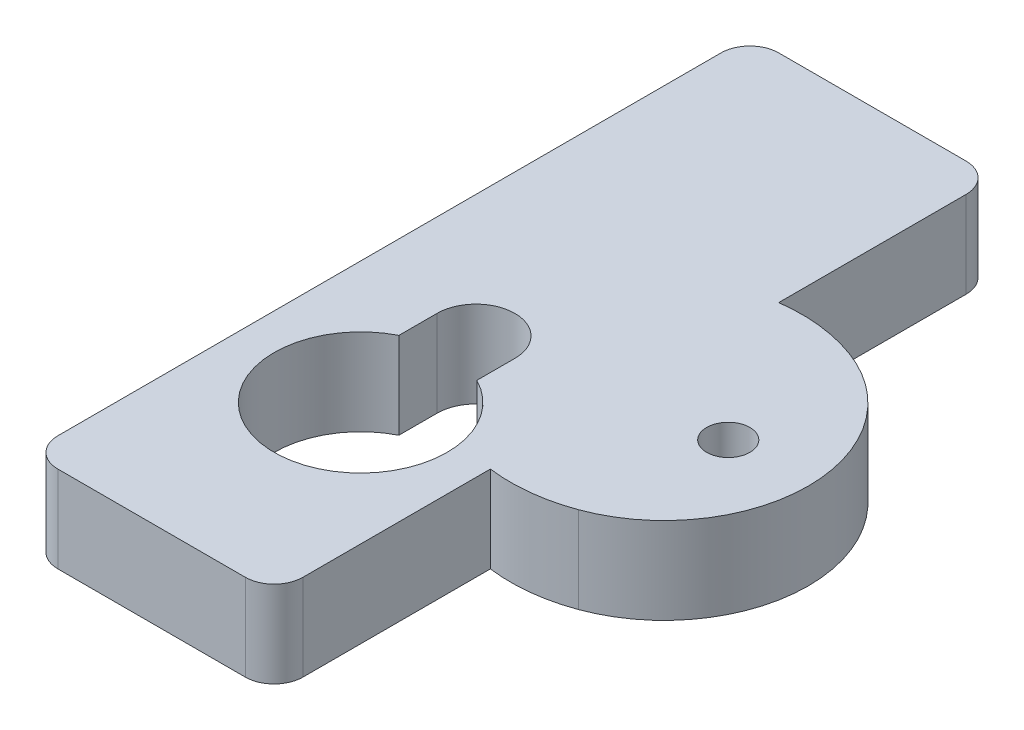
from build123d import *

# Parameters (mm, degrees)
ESQUISSE1_R        = 1.5
BOSS_EXTRU_2_DEPTH = 6
CONG_2_R           = 2
CONG_3_R           = 10


with BuildPart() as part:
    # Esquisse1 → Boss.-Extru.2 (new body)
    with BuildSketch(Plane(origin=(0, 0, 0), x_dir=(1, 0, 0), z_dir=(0, 1, 0))):
        with BuildLine():
            Line((0, 0), (17, 0))
            Line((17, 0), (17, 15))
            ThreePointArc((17, 15), (25.571067812, 17.307611845), (30, 25))
            ThreePointArc((30, 25), (25.571067812, 32.692388155), (17, 35))
            Line((17, 35), (17, 50))
            Line((17, 50), (0, 50))
            Line((0, 50), (0, 0))
        make_face()
        with BuildLine():
            ThreePointArc((5.798134367, 22.5), (8.5, 25.201865633), (11.201865633, 22.5))
            Line((11.201865633, 22.5), (11.201865633, 19.857230824))
            ThreePointArc((11.201865633, 19.857230824), (8.5, 8.5), (5.798134367, 19.857230824))
            Line((5.798134367, 19.857230824), (5.798134367, 22.5))
        make_face(mode=Mode.SUBTRACT)
        with Locations(Location((23.5, 25, 0), (0, 0, 270))):
            Circle(ESQUISSE1_R, mode=Mode.SUBTRACT)
    extrude(amount=BOSS_EXTRU_2_DEPTH)

    # Congé2
    cong_2_edges = [part.edges().sort_by_distance(p)[0] for p in [
        (17, 3, 0),
        (0, 3, 0),
        (0, 3, -50),
        (17, 3, -50),
    ]]
    fillet(cong_2_edges, radius=CONG_2_R)

    # Congé3
    # the kernel refuses this fillet: 10 mm, written as the material it takes off along each edge
    with BuildSketch(Plane(origin=(30, -30.063050545, -25), x_dir=(-0.6246887700874293, 0, 0.7808738313752451), z_dir=(0, 1, 0))) as cong_3_piece_1:
        with BuildLine():
            CenterArc((6.840779647, -8.551115481), CONG_3_R, 58.772060321, 139.774574658)
            ThreePointArc((-2.639871114, -11.731879721), (-2.959277225, -5.497060293), (0, 0))
            ThreePointArc((0, 0), (6.012610109, 1.680331289), (12.025220218, 0))
        make_face()
    extrude(amount=66.126101089, mode=Mode.SUBTRACT)


solid = part.part
